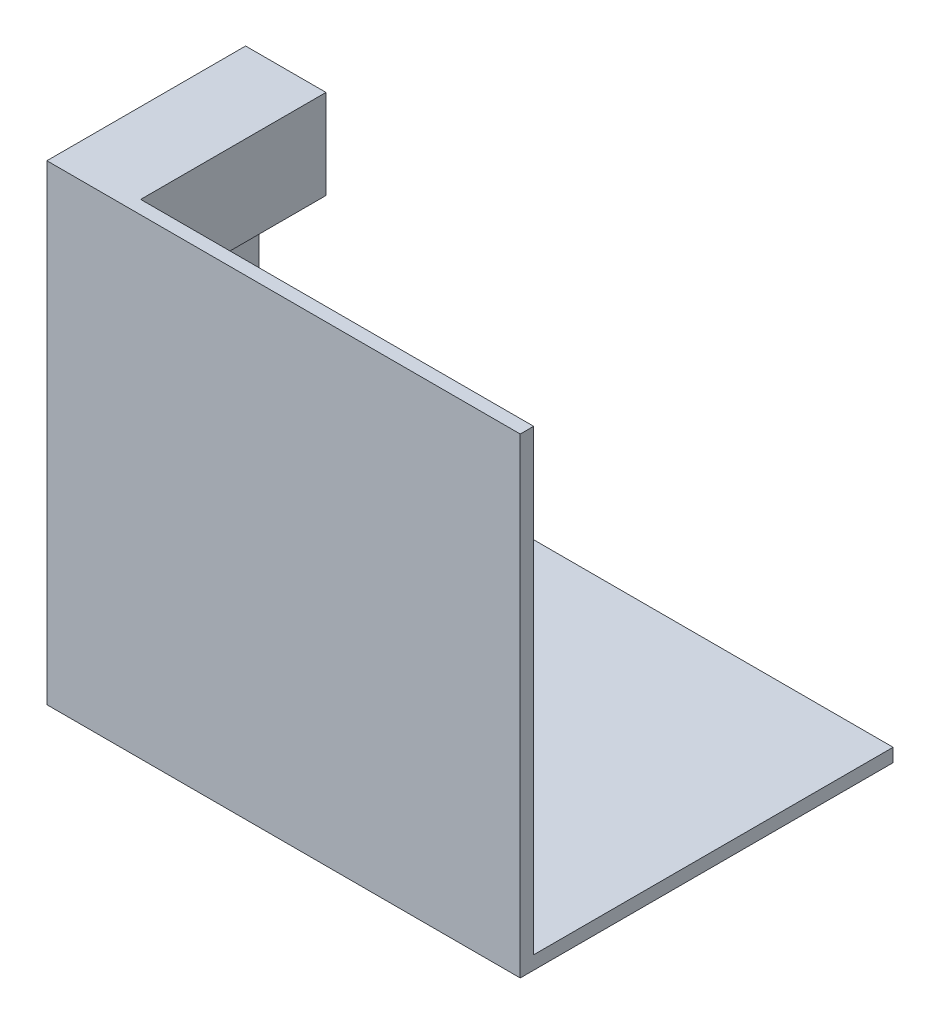
from build123d import *

# Parameters (mm, degrees)
SKETCH1_W                = 100
SKETCH1_H                = 77.5
BOSS_EXTRUDE1_DEPTH      = 3
BOSS_EXTRUDE2_DEPTH      = 102.5
BOSS_EXTRUDE2_DEPTH_BACK = 3
SKETCH2_W                = 106
SKETCH2_H                = 83.5
SKETCH2_W_2              = 100
SKETCH2_H_2              = 77.5
SKETCH3_W                = 106
SKETCH3_H                = 102.5
CUT_EXTRUDE1_DEPTH       = 39
CUT_EXTRUDE2_REACH       = 157.272
SKETCH4_W                = 41.5
SKETCH4_H                = 102.5
SKETCH5_W                = 41.5
SKETCH5_H                = 20
BOSS_EXTRUDE3_DEPTH      = 15


with BuildPart() as part:
    # Sketch1 → Boss-Extrude1 (new body)
    with BuildSketch(Plane(origin=(0, 0, 0), x_dir=(1, 0, 0), z_dir=(0, 1, 0))):
        Rectangle(SKETCH1_W, SKETCH1_H)
    extrude(amount=BOSS_EXTRUDE1_DEPTH)

    # Sketch2 → Boss-Extrude2 (add, two sides: drawn at the far end of the back side and taken through both)
    with BuildSketch(Plane(origin=(0, 3, 0), x_dir=(1, 0, 0), z_dir=(0, 1, 0)).offset(-BOSS_EXTRUDE2_DEPTH_BACK)):
        Rectangle(SKETCH2_W, SKETCH2_H)
        Rectangle(SKETCH2_W_2, SKETCH2_H_2, mode=Mode.SUBTRACT)
    extrude(amount=BOSS_EXTRUDE2_DEPTH + BOSS_EXTRUDE2_DEPTH_BACK)

    # Sketch3 → Cut-Extrude1 (cut)
    with BuildSketch(Plane(origin=(0, 0, -41.75), x_dir=(-1, 0, 0), z_dir=(0, 0, -1))):
        with Locations((0, 54.25)):
            Rectangle(SKETCH3_W, SKETCH3_H)
    extrude(amount=-CUT_EXTRUDE1_DEPTH, mode=Mode.SUBTRACT)

    # Sketch4 → Cut-Extrude2 (cut, up to next)
    with BuildSketch(Plane(origin=(53, 0, 0), x_dir=(0, 0, -1), z_dir=(1, 0, 0)), mode=Mode.PRIVATE) as cut_extrude2_sk1:
        with Locations((-18, 54.25)):
            Rectangle(SKETCH4_W, SKETCH4_H)
    cut_extrude2_tool1 = extrude(cut_extrude2_sk1.sketch, amount=-CUT_EXTRUDE2_REACH, mode=Mode.PRIVATE) & part.part
    add(cut_extrude2_tool1.solids().sort_by_distance((53, 54.25, 18))[0], mode=Mode.SUBTRACT)

    # Sketch5 → Boss-Extrude3 (add)
    with BuildSketch(Plane(origin=(-50, 0, 0), x_dir=(0, 0, -1), z_dir=(1, 0, 0))):
        with Locations((-18, 95.5)):
            Rectangle(SKETCH5_W, SKETCH5_H)
    extrude(amount=BOSS_EXTRUDE3_DEPTH)


solid = part.part
